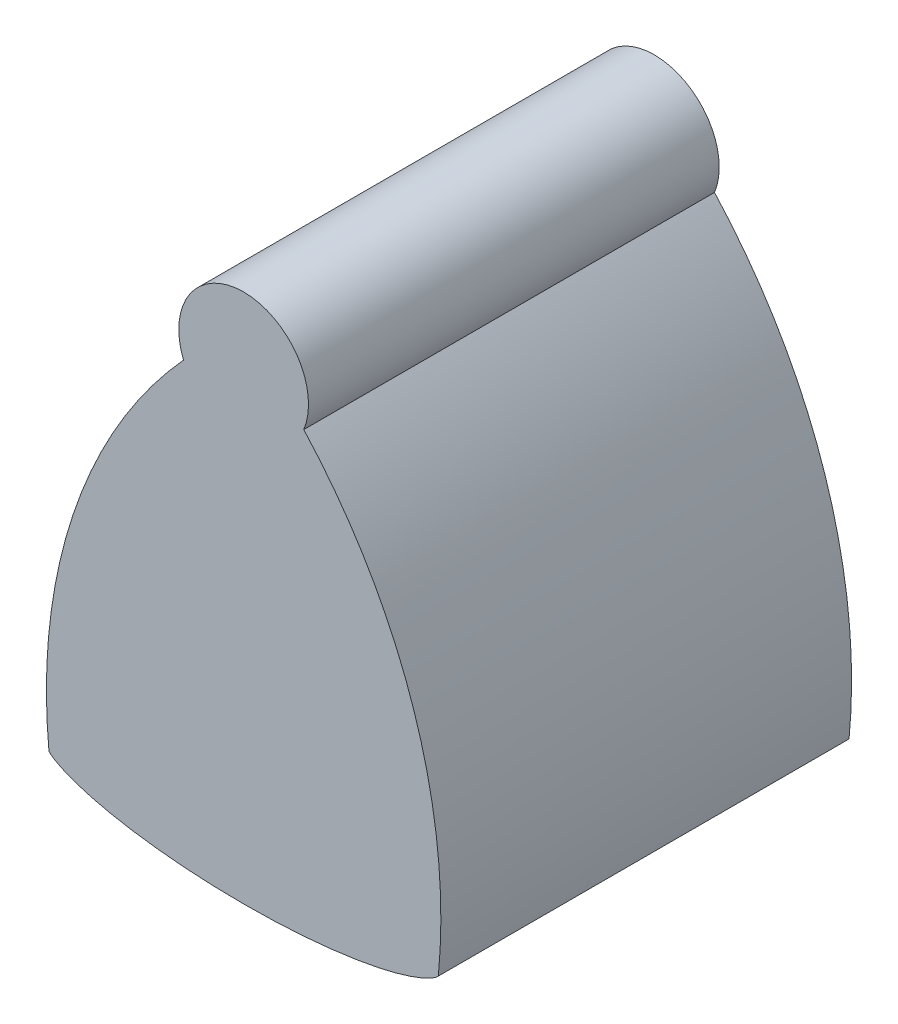
from build123d import *

# Parameters (mm, degrees)
EXTRUDE_1_DEPTH     = 3.8
CUT_EXTRUDE_START   = -3.8
CUT_EXTRUDE_1_DEPTH = 3.8


# Read off the part's stored shape, not the designer's step: Вырез-Вытянуть-Тонкостенный1
with BuildPart() as part:
    # Эскиз1 → Бобышка-Вытянуть1 (new body)
    with BuildSketch(Plane.XY):
        with BuildLine():
            ThreePointArc((-0.780530418, 1.824579743), (-1.785343213, 0.036245206), (-2, -2.003782154))
            add(Edge.make_bspline(
                [(-2, -2.003782154), (-2, -2.503782154), (0, -2.503782154), (2, -2.503782154), (2, -2.003782154)],
                knots=[3.141592654, 3.141592654, 3.141592654, 4.71238898, 4.71238898, 6.283185307, 6.283185307, 6.283185307], degree=2, weights=[1, 0.707106781, 1, 0.707106781, 1]))
            ThreePointArc((2, -2.003782154), (1.785343213, 0.036245206), (0.780530418, 1.824579743))
            ThreePointArc((0.780530418, 1.824579743), (0, 2.8), (-0.780530418, 1.824579743))
        make_face()
    extrude(amount=EXTRUDE_1_DEPTH)

    # Вырез-Вытянуть-Тонкостенный1 outline → Вырез-Вытянуть-Тонкостенный1 (cut)
    with BuildSketch(Plane.XY.offset(3.8).offset(CUT_EXTRUDE_START)):
        with BuildLine():
            ThreePointArc((-0.780530418, 1.824579743), (-1.785343213, 0.036245206), (-2, -2.003782154))
            add(Edge.make_bspline(
                [(-2, -2.003782154), (-2, -2.503782154), (0, -2.503782154), (2, -2.503782154), (2, -2.003782154)],
                knots=[3.141592654, 3.141592654, 3.141592654, 4.71238898, 4.71238898, 6.283185307, 6.283185307, 6.283185307], degree=2, weights=[1, 0.707106781, 1, 0.707106781, 1]))
            ThreePointArc((2, -2.003782154), (1.785343213, 0.036245206), (0.780530418, 1.824579743))
            ThreePointArc((0.780530418, 1.824579743), (0, 2.8), (-0.780530418, 1.824579743))
        make_face()
        with BuildLine():
            add(Edge.make_bspline(
                [(-1.801261293, -1.98115767), (-1.775418362, -2.008670603), (-1.739425369, -2.028127074), (-1.670449757, -2.063299705), (-1.634778536, -2.078378197), (-1.525887333, -2.119634895), (-1.451274856, -2.141581404), (-1.227183168, -2.19853734), (-1.075766919, -2.224988673), (-0.618423536, -2.286710762), (-0.309020677, -2.303779282), (0.308875657, -2.303785026), (0.616691935, -2.286918168), (1.075956117, -2.224976253), (1.228236922, -2.198356993), (1.453011363, -2.141095645), (1.527081769, -2.119224419), (1.635211184, -2.078192937), (1.670841705, -2.063129566), (1.739968072, -2.027820204), (1.77534781, -2.008745714), (1.801261293, -1.98115767)],
                knots=[0, 0, 0, 0, 0.03125, 0.03125, 0.0625, 0.0625, 0.125, 0.125, 0.25, 0.25, 0.5, 0.5, 0.75, 0.75, 0.875, 0.875, 0.9375, 0.9375, 0.96875, 0.96875, 1, 1, 1, 1], degree=3))
            ThreePointArc((-1.801261293, -1.98115767), (-1.577323761, 0.029258889), (-0.55646432, 1.775617603))
            ThreePointArc((-0.55646432, 1.775617603), (0, 2.6), (0.55646432, 1.775617603))
            ThreePointArc((0.55646432, 1.775617603), (1.577323761, 0.029258889), (1.801261293, -1.98115767))
        make_face(mode=Mode.SUBTRACT)
    extrude(amount=CUT_EXTRUDE_1_DEPTH, mode=Mode.SUBTRACT)


solid = part.part
